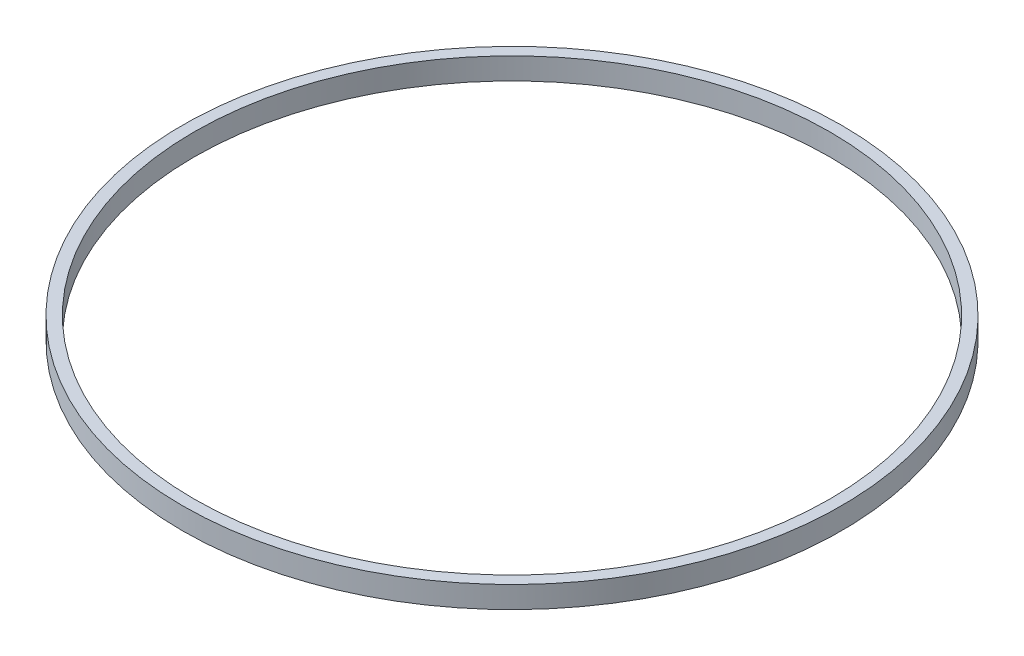
from build123d import *

# Parameters (mm, degrees)
SKETCH1_R           = 45.4152
SKETCH1_R_2         = 43.815
EXTRUDE_THIN1_DEPTH = 2.9972


with BuildPart() as part:
    # Sketch1 → Extrude-Thin1 (new body)
    with BuildSketch(Plane(origin=(0, 0, 0), x_dir=(1, 0, 0), z_dir=(0, 1, 0))):
        Circle(SKETCH1_R)
        Circle(SKETCH1_R_2, mode=Mode.SUBTRACT)
    extrude(amount=EXTRUDE_THIN1_DEPTH)


solid = part.part
